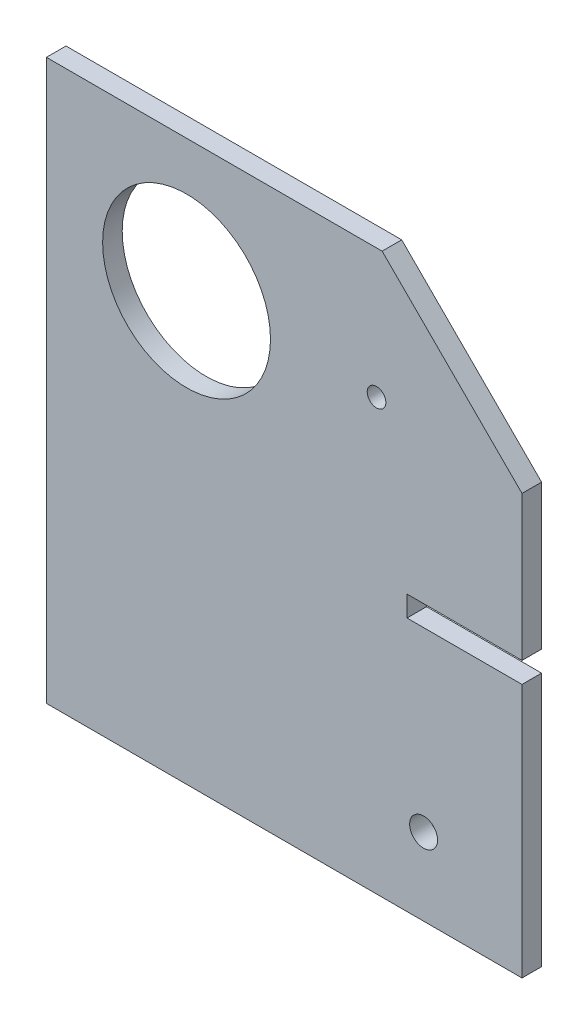
from build123d import *

# Parameters (mm, degrees)
SKETCH1_W           = 170
SKETCH1_H           = 200
BOSS_EXTRUDE1_DEPTH = 7
CHAMFER1_SIZE       = 50
SKETCH2_R           = 3.325255306
SKETCH2_R_2         = 4.992144286
SKETCH2_W           = 41.115622252
SKETCH2_H           = 7.424048867
CUT_EXTRUDE1_DEPTH  = 10
SKETCH3_R           = 30
CUT_EXTRUDE2_DEPTH  = 10


with BuildPart() as part:
    # Sketch1 → Boss-Extrude1 (new body)
    with BuildSketch(Plane.XY):
        with Locations((71.676783005, -86.737481032)):
            Rectangle(SKETCH1_W, SKETCH1_H)
    extrude(amount=BOSS_EXTRUDE1_DEPTH)

    # Chamfer1
    chamfer1_edges = [part.edges().sort_by_distance(p)[0] for p in [
        (156.676783005, 13.262518968, 3.5),
    ]]
    chamfer(chamfer1_edges, length=CHAMFER1_SIZE)

    # Sketch2 → Cut-Extrude1 (cut)
    with BuildSketch(Plane.XY.offset(7)):
        with Locations((104.672555747, -32.954371461)):
            Circle(SKETCH2_R)
        with Locations((121.500399846, -159.163202203)):
            Circle(SKETCH2_R_2)
        with Locations((136.118971879, -92.146240965)):
            Rectangle(SKETCH2_W, SKETCH2_H)
    extrude(amount=-CUT_EXTRUDE1_DEPTH, mode=Mode.SUBTRACT)

    # Sketch3 → Cut-Extrude2 (cut)
    with BuildSketch(Plane.XY.offset(7)):
        with Locations((36.770676731, -33.991191506)):
            Circle(SKETCH3_R)
    extrude(amount=-CUT_EXTRUDE2_DEPTH, mode=Mode.SUBTRACT)


solid = part.part
